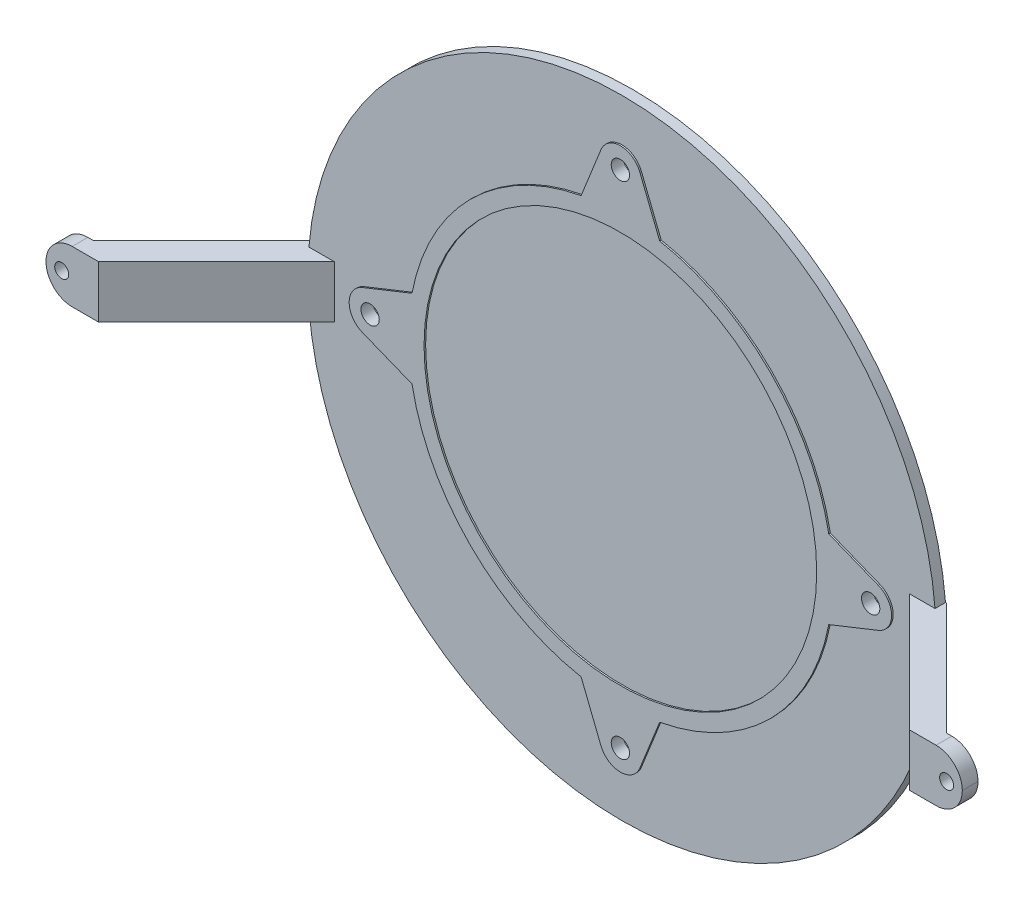
from build123d import *

# Parameters (mm, degrees)
SKETCH1_R            = 60
BOSS_EXTRUDE1_DEPTH  = 2
SKETCH4_R            = 40.5
SKETCH4_R_2          = 37.5
BOSS_EXTRUDE4_DEPTH  = 0.3
SKETCH5_R            = 1.75
BOSS_EXTRUDE5_DEPTH  = 0.3
CIRPATTERN1_COUNT    = 4
SKETCH6_R            = 1.75
CUT_EXTRUDE1_DEPTH   = 85.876380696
BOSS_EXTRUDE6_DEPTH  = 5
SKETCH8_R            = 1.337594407
CUT_EXTRUDE2_DEPTH   = 109.252020766
FILLET1_R            = 5
FILLET1_OF_MIRROR1_R = 5


with BuildPart() as part:
    # Sketch1 → Boss-Extrude1 (new body)
    with BuildSketch(Plane.XY):
        Circle(SKETCH1_R)
    extrude(amount=BOSS_EXTRUDE1_DEPTH)

    # Sketch4 → Boss-Extrude4 (add)
    with BuildSketch(Plane.XY.offset(2)):
        Circle(SKETCH4_R)
        Circle(SKETCH4_R_2, mode=Mode.SUBTRACT)
    extrude(amount=BOSS_EXTRUDE4_DEPTH)

    # Sketch5 → Boss-Extrude5 (add)
    with BuildSketch(Plane.XY.offset(2)):
        with BuildLine():
            Line((-7.5, 39.799497484), (7.5, 39.799497484))
            Line((7.5, 39.799497484), (3.715004122, 49.282313849))
            ThreePointArc((3.715004122, 49.282313849), (0, 51.799497484), (-3.715004122, 49.282313849))
            Line((-3.715004122, 49.282313849), (-7.5, 39.799497484))
        make_face()
        with Locations((0, 47.799497484)):
            Circle(SKETCH5_R, mode=Mode.SUBTRACT)
    boss_extrude5 = extrude(amount=BOSS_EXTRUDE5_DEPTH)

    # CirPattern1: Boss-Extrude5 ×4 about axis
    cirpattern1_axis = Axis((0, 0, 0), (0, 0, 1))
    for i in range(1, CIRPATTERN1_COUNT):
        add(boss_extrude5.rotate(cirpattern1_axis, i * 360 / CIRPATTERN1_COUNT))

    # Sketch6 → Cut-Extrude1 (cut, through all)
    with BuildSketch(Plane.XY.offset(2)):
        with Locations((0, 47.799497484)):
            Circle(SKETCH6_R)
        with Locations(Location((-47.799497484, 0, 0), (0, 0, 90))):
            Circle(SKETCH6_R)
        with Locations(Location((47.799497484, 0, 0), (0, 0, 270))):
            Circle(SKETCH6_R)
        with Locations(Location((0, -47.799497484, 0), (0, 0, 180))):
            Circle(SKETCH6_R)
    extrude(amount=-CUT_EXTRUDE1_DEPTH, mode=Mode.SUBTRACT)

    # Sketch7 → Boss-Extrude6 (add, symmetric)
    with BuildSketch(Plane(origin=(0, 0, 0), x_dir=(1, 0, 0), z_dir=(0, 1, 0))):
        Polygon((60, 0), (81.5, -21.5), (87.5, -21.5), (87.5, -24.5), (77.428932188, -24.5), (52.928932188, 0), align=None)
    boss_extrude6 = extrude(amount=BOSS_EXTRUDE6_DEPTH, both=True)

    # Sketch8 → Cut-Extrude2 (cut, through all)
    with BuildSketch(Plane(origin=(0, 0, 21.5), x_dir=(-1, 0, 0), z_dir=(0, 0, -1))):
        with Locations((-84.5, 0)):
            Circle(SKETCH8_R)
    cut_extrude2 = extrude(amount=-CUT_EXTRUDE2_DEPTH, mode=Mode.SUBTRACT)

    # Fillet1
    fillet1_edges = [part.edges().sort_by_distance(p)[0] for p in [
        (87.5, -5, 23),
        (87.5, 5, 23),
    ]]
    fillet(fillet1_edges, radius=FILLET1_R - 0.0001)  # a hair under: the kernel refuses the full size

    # Mirror1: Boss-Extrude6, Cut-Extrude2 across plane
    add(boss_extrude6.mirror(Plane(origin=(0, 0, 0), x_dir=(0, 0, 1), z_dir=(1, 0, 0))))
    add(cut_extrude2.mirror(Plane(origin=(0, 0, 0), x_dir=(0, 0, 1), z_dir=(1, 0, 0))), mode=Mode.SUBTRACT)

    # Fillet1 of Mirror1
    fillet1_of_mirror1_edges = [part.edges().sort_by_distance(p)[0] for p in [
        (-87.5, -5, 23),
        (-87.5, 5, 23),
    ]]
    fillet(fillet1_of_mirror1_edges, radius=FILLET1_OF_MIRROR1_R - 0.0001)  # a hair under: the kernel refuses the full size


solid = part.part
